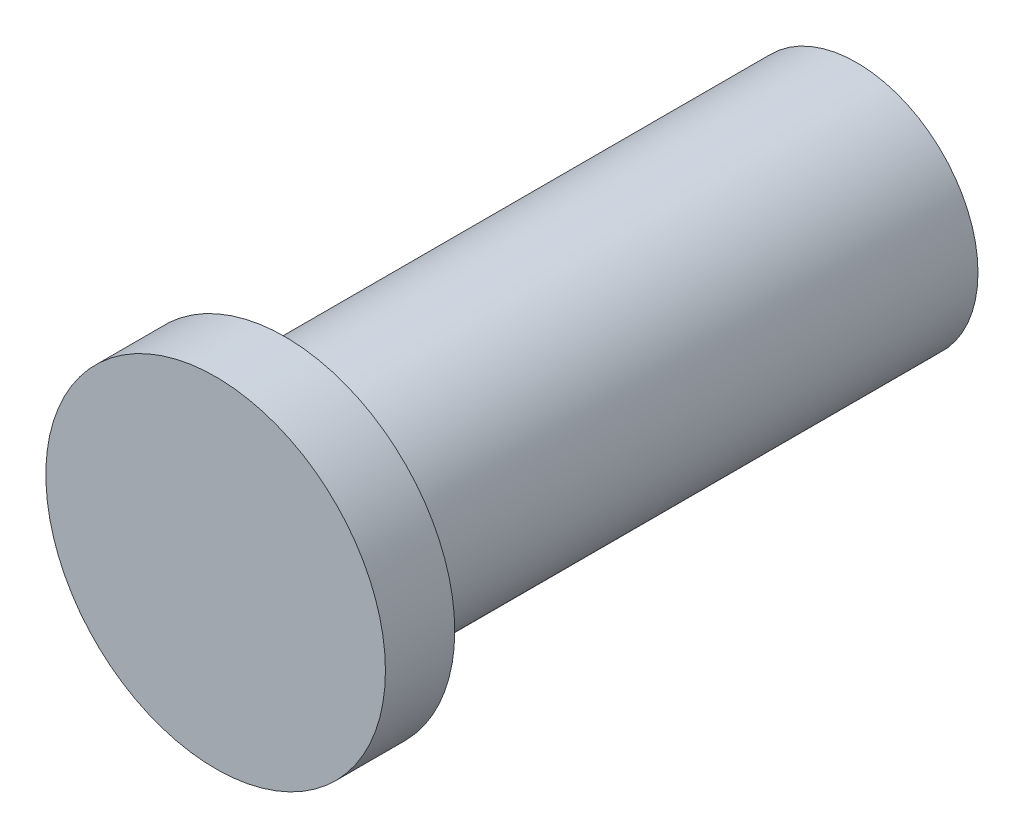
from build123d import *

# Parameters (mm, degrees)
SKETCH1_R           = 7
BOSS_EXTRUDE1_DEPTH = 33
SKETCH2_R           = 9.8
BOSS_EXTRUDE2_DEPTH = 4
SKETCH3_R           = 4.2
CUT_EXTRUDE1_DEPTH  = 15
THREAD1_PITCH       = 1


with BuildPart() as part:
    # Sketch1 → Boss-Extrude1 (new body)
    with BuildSketch(Plane.XY):
        Circle(SKETCH1_R)
    extrude(amount=BOSS_EXTRUDE1_DEPTH)

    # Sketch2 → Boss-Extrude2 (add)
    with BuildSketch(Plane.XY.offset(33)):
        Circle(SKETCH2_R)
    extrude(amount=BOSS_EXTRUDE2_DEPTH)

    # Sketch3 → Cut-Extrude1 (cut)
    with BuildSketch(Plane(origin=(0, 0, 0), x_dir=(-1, 0, 0), z_dir=(0, 0, -1))):
        Circle(SKETCH3_R)
    extrude(amount=-CUT_EXTRUDE1_DEPTH, mode=Mode.SUBTRACT)

    # Thread1: the profile of Thread Profile1 profile screwed along a right-hand helix of 15 turns, 8 arcs to a turn; built about Z, then put on its axis
    thread1_z = Axis((0, 0, 0), (0, 0, 1))
    thread1_corners = [(4.1997, 0, -0.000173205), (4.741265875, 0, 0.312499999), (4.741265875, 0, 0.437499999), (4.1997, 0, 0.750173202)]
    with BuildLine(mode=Mode.PRIVATE) as thread1_profile:
        Line(thread1_corners[0], thread1_corners[1])
        Line(thread1_corners[1], thread1_corners[2])
        Line(thread1_corners[2], thread1_corners[3])
        Line(thread1_corners[3], thread1_corners[0])
    thread1_cap = Face(thread1_profile.wire())
    thread1_turn_angles = [0, 22.5, 45, 67.5, 90, 112.5, 135, 157.5, 180, 202.5, 225, 247.5, 270, 292.5, 315, 337.5, 360]
    thread1_turn_weights = [1, 0.9238795325112867, 1, 0.9238795325112867, 1, 0.9238795325112867, 1, 0.9238795325112867, 1, 0.9238795325112867, 1, 0.9238795325112867, 1, 0.9238795325112867, 1, 0.9238795325112867, 1]
    thread1_turn_rails = [Edge.make_bspline([Vector(p[0], p[1], 0).rotate(thread1_z, thread1_turn_angles[k]) / thread1_turn_weights[k] + Vector(0, 0, p[2] + THREAD1_PITCH * thread1_turn_angles[k] / 360) for k in range(17)], [0, 0, 0, 1, 1, 2, 2, 3, 3, 4, 4, 5, 5, 6, 6, 7, 7, 8, 8, 8], 2, thread1_turn_weights) for p in thread1_corners]
    thread1_turn_sides = [Face.make_surface_from_curves(thread1_turn_rails[p[0]], thread1_turn_rails[p[1]]) for p in [(0, 1), (1, 2), (2, 3), (3, 0)]]
    thread1 = Plane(origin=(0, 0, 15), x_dir=(-1, 0, 0), z_dir=(0, 0, -1)) * Solid(Shell([*[p.moved(Location((0, 0, THREAD1_PITCH * i))) for i in range(15) for p in thread1_turn_sides], thread1_cap, thread1_cap.rotate(thread1_z, 5400).moved(Location((0, 0, THREAD1_PITCH * 5400 / 360)))]))
    add(thread1, mode=Mode.SUBTRACT)


solid = part.part
